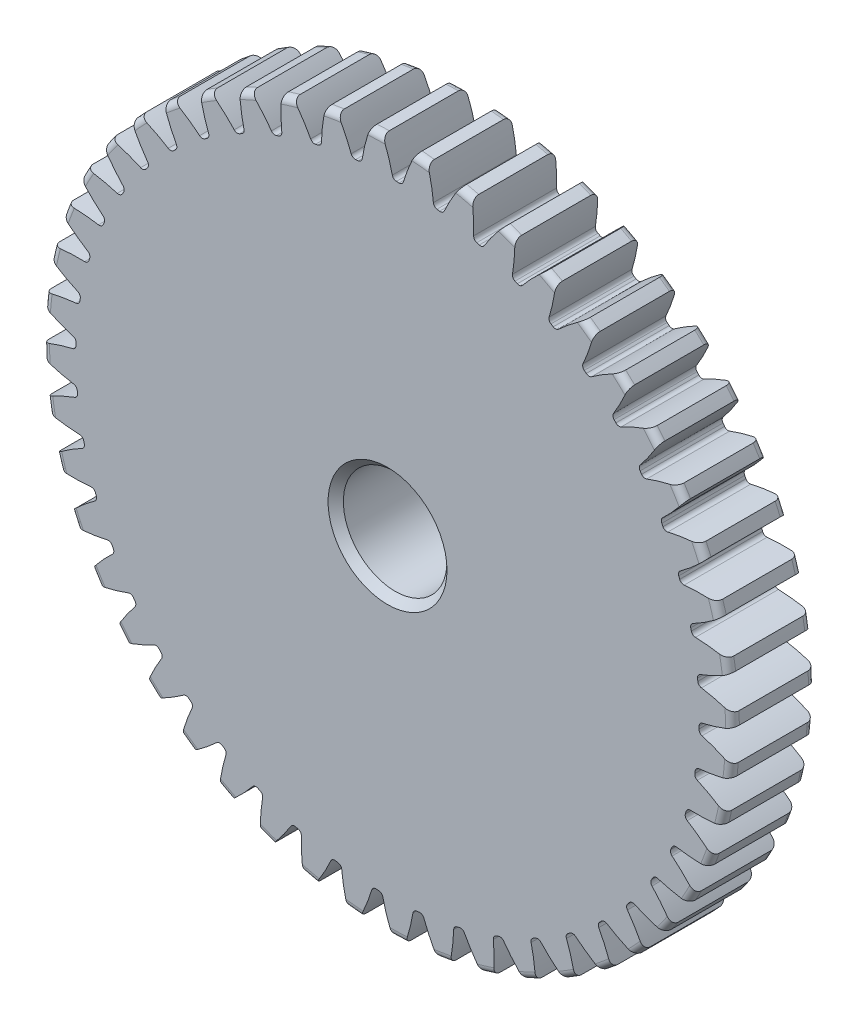
from build123d import *

# Parameters (mm, degrees)
SKETCH1_R                = 26.416
BOSS_EXTRUDE1_DEPTH      = 6.35
SKETCH2_W                = 7.874
SKETCH2_H                = 11.7078125
FILLET2_R                = 0.52832
CUT_EXTRUDE1_DEPTH       = 40.97414531
FILLET1_R                = 0.332486
CIRPATTERN1_COUNT        = 48
FILLET1_OF_CIRPATTERN1_R = 0.332486
SKETCH5_R                = 3.96875
CUT_EXTRUDE2_DEPTH       = 40.970248748
CHAMFER1_SIZE            = 0.585390625


with BuildPart() as part:
    # Sketch1 → Boss-Extrude1 (new body)
    with BuildSketch(Plane.XY):
        Circle(SKETCH1_R)
    extrude(amount=-BOSS_EXTRUDE1_DEPTH)

    # Sketch2 → Revolve1 (revolve)
    with BuildSketch(Plane(origin=(0, 0, 0), x_dir=(0, 0, -1), z_dir=(1, 0, 0))):
        with Locations((10.287, 5.85390625)):
            Rectangle(SKETCH2_W, SKETCH2_H)
    revolve(axis=Axis((0, 0, -6.35), (0, 0, -1)))

    # Fillet2
    fillet2_edges = [part.edges().sort_by_distance(p)[0] for p in [
        (-26.416, 0, -6.35),
        (-26.416, 0, 0),
        (0, -11.7078125, -6.35),
    ]]
    fillet(fillet2_edges, radius=FILLET2_R)

    # Sketch4 → Cut-Extrude1 (cut, through all)
    with BuildSketch(Plane.XY):
        with BuildLine():
            ThreePointArc((1.140070311, 23.840949145), (0.780947195, 23.855413179), (0.421646998, 23.864467944))
            add(Edge.make_bspline(
                [(-6.71429462, 33.096013011), (-0.802956981, 29.648538809), (0.421646998, 23.864467944)],
                knots=[0, 0, 0, 1, 1, 1], degree=2))
            ThreePointArc((-6.71429462, 33.096013011), (1.104933242, 33.752139962), (8.864506603, 32.586014671))
            add(Edge.make_bspline(
                [(8.864506603, 32.586014671), (2.740349523, 29.532542693), (1.140070311, 23.840949145)],
                knots=[0, 0, 0, 1, 1, 1], degree=2))
        make_face()
    cut_extrude1 = extrude(amount=-CUT_EXTRUDE1_DEPTH, mode=Mode.SUBTRACT)

    # Fillet1
    fillet1_edges = [part.edges().sort_by_distance(p)[0] for p in [
        (1.140070311, 23.840949145, -3.175),
        (0.421646998, 23.864467944, -3.175),
    ]]
    fillet(fillet1_edges, radius=FILLET1_R)

    # CirPattern1: Cut-Extrude1 ×48 about axis
    cirpattern1_axis = Axis((0, 0, -6.35), (0, 0, 1))
    for i in range(1, CIRPATTERN1_COUNT):
        add(cut_extrude1.rotate(cirpattern1_axis, i * 360 / CIRPATTERN1_COUNT), mode=Mode.SUBTRACT)

    # Fillet1 of CirPattern1
    fillet1_of_cirpattern1_edges = [part.edges().sort_by_distance(p)[0] for p in [
        (-1.98155146, 23.785795557, -3.175),
        (-2.696898381, 23.71534009, -3.175),
        (-5.069268335, 23.323660412, -3.175),
        (-5.769299081, 23.160436191, -3.175),
        (-8.070248624, 22.462450971, -3.175),
        (-8.742985473, 22.209250808, -3.175),
        (-10.933144721, 21.216902766, -3.175),
        (-11.567076961, 20.878058987, -3.175),
        (-13.608971681, 19.608327472, -3.175),
        (-14.193252554, 19.189637787, -3.175),
        (-16.051945363, 17.664248258, -3.175),
        (-16.576577662, 17.172876564, -3.175),
        (-18.220265809, 15.41792886, -3.175),
        (-18.676272929, 14.862282662, -3.175),
        (-20.076832455, 12.907804424, -3.175),
        (-20.456411989, 12.297390984, -3.175),
        (-21.589878931, 10.176823875, -3.175),
        (-21.886536168, 9.522087536, -3.175),
        (-22.733516593, 7.271715049, -3.175),
        (-22.942175645, 6.58385853, -3.175),
        (-23.488177484, 4.242185162, -3.175),
        (-23.605268136, 3.532977879, -3.175),
        (-23.840949145, 1.140070311, -3.175),
        (-23.864467944, 0.421646998, -3.175),
        (-23.785795557, -1.98155146, -3.175),
        (-23.71534009, -2.696898381, -3.175),
        (-23.323660412, -5.069268335, -3.175),
        (-23.160436191, -5.769299081, -3.175),
        (-22.462450971, -8.070248624, -3.175),
        (-22.209250808, -8.742985473, -3.175),
        (-21.216902766, -10.933144721, -3.175),
        (-20.878058987, -11.567076961, -3.175),
        (-19.608327472, -13.608971681, -3.175),
        (-19.189637787, -14.193252554, -3.175),
        (-17.664248258, -16.051945363, -3.175),
        (-17.172876564, -16.576577662, -3.175),
        (-15.41792886, -18.220265809, -3.175),
        (-14.862282662, -18.676272929, -3.175),
        (-12.907804424, -20.076832455, -3.175),
        (-12.297390984, -20.456411989, -3.175),
        (-10.176823875, -21.589878931, -3.175),
        (-9.522087536, -21.886536168, -3.175),
        (-7.271715049, -22.733516593, -3.175),
        (-6.58385853, -22.942175645, -3.175),
        (-4.242185162, -23.488177484, -3.175),
        (-3.532977879, -23.605268136, -3.175),
        (-1.140070311, -23.840949145, -3.175),
        (-0.421646998, -23.864467944, -3.175),
        (1.98155146, -23.785795557, -3.175),
        (2.696898381, -23.71534009, -3.175),
        (5.069268335, -23.323660412, -3.175),
        (5.769299081, -23.160436191, -3.175),
        (8.070248624, -22.462450971, -3.175),
        (8.742985473, -22.209250808, -3.175),
        (10.933144721, -21.216902766, -3.175),
        (11.567076961, -20.878058987, -3.175),
        (13.608971681, -19.608327472, -3.175),
        (14.193252554, -19.189637787, -3.175),
        (16.051945363, -17.664248258, -3.175),
        (16.576577662, -17.172876564, -3.175),
        (18.220265809, -15.41792886, -3.175),
        (18.676272929, -14.862282662, -3.175),
        (20.076832455, -12.907804424, -3.175),
        (20.456411989, -12.297390984, -3.175),
        (21.589878931, -10.176823875, -3.175),
        (21.886536168, -9.522087536, -3.175),
        (22.733516593, -7.271715049, -3.175),
        (22.942175645, -6.58385853, -3.175),
        (23.488177484, -4.242185162, -3.175),
        (23.605268136, -3.532977879, -3.175),
        (23.840949145, -1.140070311, -3.175),
        (23.864467944, -0.421646998, -3.175),
        (23.785795557, 1.98155146, -3.175),
        (23.71534009, 2.696898381, -3.175),
        (23.323660412, 5.069268335, -3.175),
        (23.160436191, 5.769299081, -3.175),
        (22.462450971, 8.070248624, -3.175),
        (22.209250808, 8.742985473, -3.175),
        (21.216902766, 10.933144721, -3.175),
        (20.878058987, 11.567076961, -3.175),
        (19.608327472, 13.608971681, -3.175),
        (19.189637787, 14.193252554, -3.175),
        (17.664248258, 16.051945363, -3.175),
        (17.172876564, 16.576577662, -3.175),
        (15.41792886, 18.220265809, -3.175),
        (14.862282662, 18.676272929, -3.175),
        (12.907804424, 20.076832455, -3.175),
        (12.297390984, 20.456411989, -3.175),
        (10.176823875, 21.589878931, -3.175),
        (9.522087536, 21.886536168, -3.175),
        (7.271715049, 22.733516593, -3.175),
        (6.58385853, 22.942175645, -3.175),
        (4.242185162, 23.488177484, -3.175),
        (3.532977879, 23.605268136, -3.175),
    ]]
    fillet(fillet1_of_cirpattern1_edges, radius=FILLET1_OF_CIRPATTERN1_R)

    # Sketch5 → Cut-Extrude2 (cut, through all)
    with BuildSketch(Plane.XY):
        Circle(SKETCH5_R)
    extrude(amount=-CUT_EXTRUDE2_DEPTH, mode=Mode.SUBTRACT)

    # Chamfer1
    chamfer1_edges = [part.edges().sort_by_distance(p)[0] for p in [
        (0, -11.7078125, -14.224),
        (-3.96875, 0, 0),
        (-3.96875, 0, -14.224),
    ]]
    chamfer(chamfer1_edges, length=CHAMFER1_SIZE)


solid = part.part
